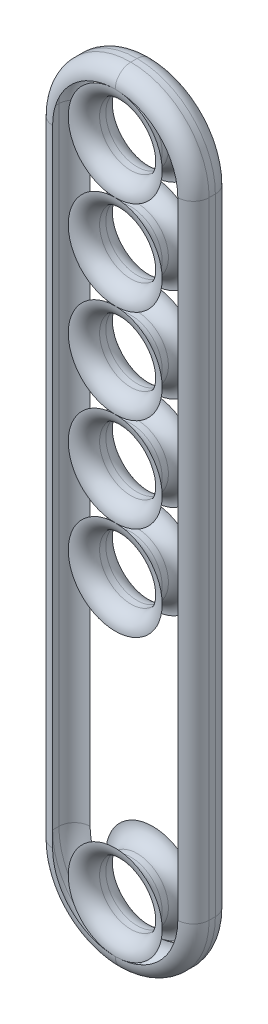
from build123d import *

# Parameters (mm, degrees)
SKETCH1_W           = 10
SKETCH1_H           = 50
BOSS_EXTRUDE1_DEPTH = 2.4
SKETCH2_R           = 2
CUT_EXTRUDE1_DEPTH  = 52.046645335
FILLET2_R           = 5
FILLET1_R           = 1


with BuildPart() as part:
    # Sketch1 → Boss-Extrude1 (new body)
    with BuildSketch(Plane.XY):
        with Locations((5, 25)):
            Rectangle(SKETCH1_W, SKETCH1_H)
    extrude(amount=BOSS_EXTRUDE1_DEPTH)

    # Sketch2 → Cut-Extrude1 (cut, through all)
    with BuildSketch(Plane.XY.offset(2.4)):
        with Locations((5, 46)):
            Circle(SKETCH2_R)
        with Locations((5, 4)):
            Circle(SKETCH2_R)
        with Locations((5, 40)):
            Circle(SKETCH2_R)
        with Locations((5, 34)):
            Circle(SKETCH2_R)
        with Locations((5, 28)):
            Circle(SKETCH2_R)
        with Locations((5, 22)):
            Circle(SKETCH2_R)
    extrude(amount=-CUT_EXTRUDE1_DEPTH, mode=Mode.SUBTRACT)

    # Fillet2
    fillet2_edges = [part.edges().sort_by_distance(p)[0] for p in [
        (0, 0, 1.2),
        (10, 0, 1.2),
        (10, 50, 1.2),
        (0, 50, 1.2),
    ]]
    fillet(fillet2_edges, radius=FILLET2_R - 0.0001)  # a hair under: the kernel refuses the full size

    # Fillet1
    fillet1_edges = [part.edges().sort_by_distance(p)[0] for p in [
        (3, 46, 0),
        (3, 46, 2.4),
        (3, 22, 0),
        (3, 22, 2.4),
        (3, 34, 0),
        (3, 34, 2.4),
        (3, 40, 0),
        (3, 40, 2.4),
        (3, 28, 0),
        (3, 28, 2.4),
        (3, 4, 0),
        (3, 4, 2.4),
        (0, 25, 0),
        (10, 25, 0),
        (1.464436805, 48.535563195, 0),
        (8.535563195, 48.535563195, 0),
        (8.535563195, 1.464436805, 0),
        (1.464436805, 1.464436805, 0),
        (0, 25, 2.4),
        (10, 25, 2.4),
        (1.464436805, 48.535563195, 2.4),
        (8.535563195, 48.535563195, 2.4),
        (8.535563195, 1.464436805, 2.4),
        (1.464436805, 1.464436805, 2.4),
    ]]
    fillet(fillet1_edges, radius=FILLET1_R - 0.0001)  # a hair under: the kernel refuses the full size


solid = part.part
